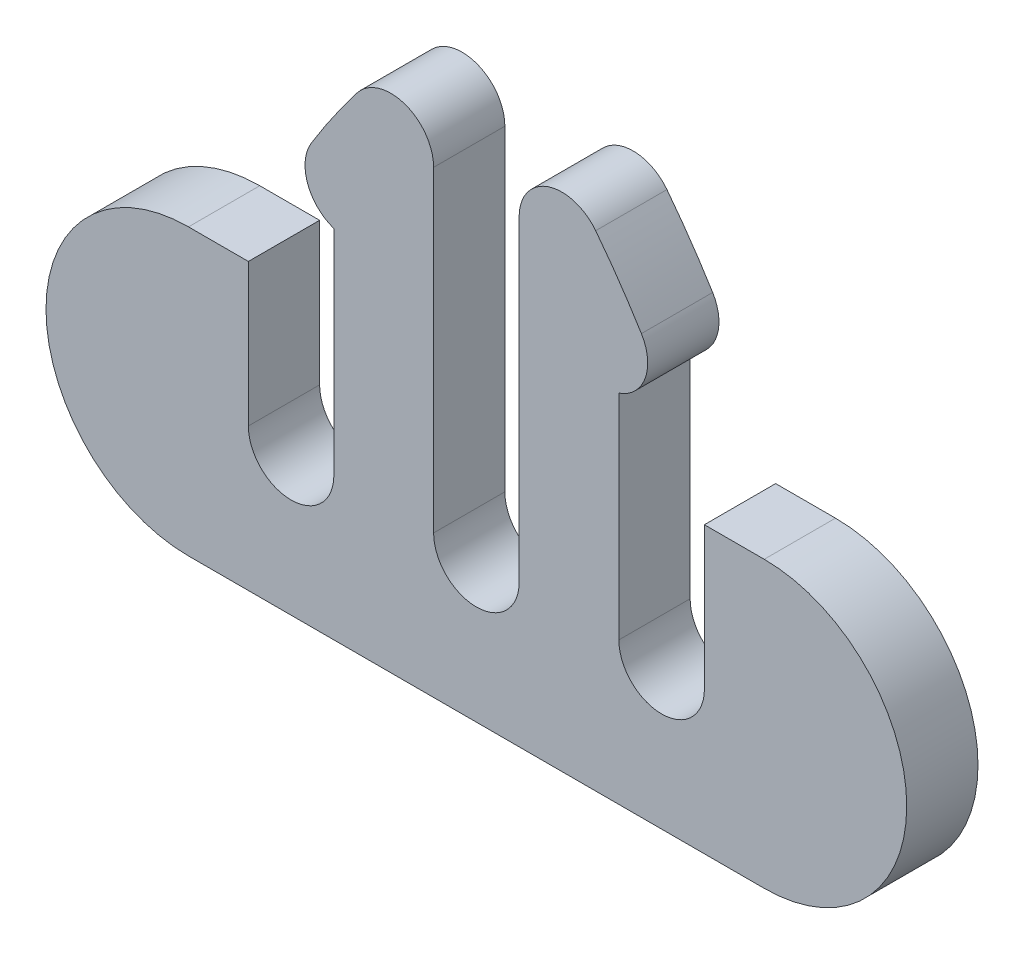
from build123d import *

# Parameters (mm, degrees)
BOSS_EXTRUDE1_DEPTH = 2.5
CUT_EXTRUDE1_START  = -2.5
CUT_EXTRUDE1_DEPTH  = 2.5
FILLET1_R           = 1.5
FILLET2_R           = 1.5


with BuildPart() as part:
    # Sketch1 → Boss-Extrude1 (new body)
    with BuildSketch(Plane.XY):
        with BuildLine():
            Line((-22.837615564, 46.083177434), (-27.937615564, 46.083177434))
            ThreePointArc((-27.937615564, 46.083177434), (-32.937615564, 41.083177434), (-27.937615564, 36.083177434))
            Line((-27.937615564, 36.083177434), (-7.737615564, 36.083177434))
            ThreePointArc((-7.737615564, 36.083177434), (-2.737615564, 41.083177434), (-7.737615564, 46.083177434))
            Line((-7.737615564, 46.083177434), (-12.837615564, 46.083177434))
            Line((-12.837615564, 46.083177434), (-12.837615564, 48.583177434))
            Line((-12.837615564, 48.583177434), (-10.837615564, 48.583177434))
            add(Edge.make_bspline(
                [(-16.337615564, 56.083177434), (-12.915611401, 52.825980487), (-10.837615564, 48.583177434)],
                knots=[0, 0, 0, 1, 1, 1], degree=2))
            Line((-16.337615564, 56.083177434), (-16.337615564, 46.083177434))
            ThreePointArc((-16.337615564, 46.083177434), (-17.837615564, 44.583177434), (-19.337615564, 46.083177434))
            Line((-19.337615564, 46.083177434), (-19.337615564, 56.083177434))
            add(Edge.make_bspline(
                [(-19.337615564, 56.083177434), (-22.759619727, 52.825980487), (-24.837615564, 48.583177434)],
                knots=[0, 0, 0, 1, 1, 1], degree=2))
            Line((-24.837615564, 48.583177434), (-22.837615564, 48.583177434))
            Line((-22.837615564, 48.583177434), (-22.837615564, 46.083177434))
        make_face()
    extrude(amount=BOSS_EXTRUDE1_DEPTH)

    # Sketch2 → Cut-Extrude1 (cut)
    with BuildSketch(Plane.XY.offset(2.5).offset(CUT_EXTRUDE1_START)):
        with BuildLine():
            Line((-9.837615564, 46.083177434), (-9.837615564, 41.083177434))
            ThreePointArc((-9.837615564, 41.083177434), (-11.337615564, 39.583177434), (-12.837615564, 41.083177434))
            Line((-12.837615564, 41.083177434), (-12.837615564, 46.083177434))
            ThreePointArc((-12.837615564, 46.083177434), (-11.337615564, 47.583177434), (-9.837615564, 46.083177434))
        make_face()
        with BuildLine():
            Line((-25.837615564, 46.083177434), (-25.837615564, 41.083177434))
            ThreePointArc((-25.837615564, 41.083177434), (-24.337615564, 39.583177434), (-22.837615564, 41.083177434))
            Line((-22.837615564, 41.083177434), (-22.837615564, 46.083177434))
            ThreePointArc((-22.837615564, 46.083177434), (-24.337615564, 47.583177434), (-25.837615564, 46.083177434))
        make_face()
        with BuildLine():
            Line((-19.337615564, 46.083177434), (-19.337615564, 41.083177434))
            ThreePointArc((-19.337615564, 41.083177434), (-17.837615564, 39.583177434), (-16.337615564, 41.083177434))
            Line((-16.337615564, 41.083177434), (-16.337615564, 46.083177434))
            ThreePointArc((-16.337615564, 46.083177434), (-17.837615564, 47.583177434), (-19.337615564, 46.083177434))
        make_face()
    extrude(amount=CUT_EXTRUDE1_DEPTH, mode=Mode.SUBTRACT)

    # Fillet1
    # the kernel refuses this fillet: 1.5 mm, written as the material it takes off along each edge
    with BuildSketch(Plane(origin=(-10.837615564, 48.583177434, -6.280550784), x_dir=(-1, 0, 0), z_dir=(0, 0, 1))) as fillet1_piece_1:
        with BuildLine():
            CenterArc((2.488462024, -1.418240054), FILLET1_R, 109.004435481, 102.492563124)
            Line((1.209460724, -2.201920903), (1.183880698, -2.21759452))
            ThreePointArc((1.183880698, -2.21759452), (0.552459457, -1.12966162), (-0.026942162, -0.013195451))
            Line((-0.026942162, -0.013195451), (0, 0.03))
            ThreePointArc((0, 0.03), (1, 0.03), (1.99023076, 0.028364801))
            Line((1.99023076, 0.028364801), (2, 0))
        make_face()
    extrude(amount=15.061101567, mode=Mode.SUBTRACT)
    with BuildSketch(Plane(origin=(-24.837615564, 48.583177434, -6.280550784), x_dir=(1, 0, 0), z_dir=(0, 0, 1))) as fillet1_piece_2:
        with BuildLine():
            CenterArc((2.488462024, 1.418240054), FILLET1_R, 148.503001395, 102.492563124)
            Line((1.209460724, 2.201920903), (1.183880698, 2.21759452))
            ThreePointArc((1.183880698, 2.21759452), (0.552459457, 1.12966162), (-0.026942162, 0.013195451))
            Line((-0.026942162, 0.013195451), (0, -0.03))
            ThreePointArc((0, -0.03), (1, -0.03), (1.99023076, -0.028364801))
            Line((1.99023076, -0.028364801), (2, 0))
        make_face()
    extrude(amount=15.061101567, mode=Mode.SUBTRACT)

    # Fillet2
    fillet2_edges = [part.edges().sort_by_distance(p)[0] for p in [
        (-16.337615564, 56.083177434, 1.25),
        (-19.337615564, 56.083177434, 1.25),
    ]]
    fillet(fillet2_edges, radius=FILLET2_R)


solid = part.part
